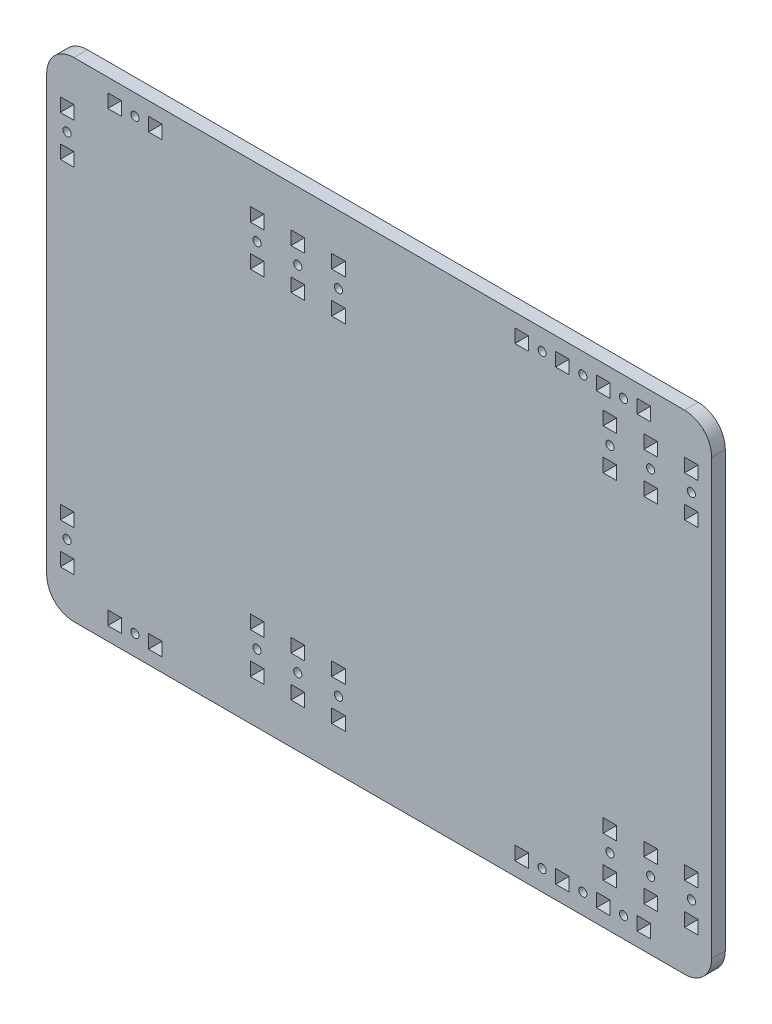
from build123d import *

# Parameters (mm, degrees)
SKETCH1_W           = 245.000446045
SKETCH1_H           = 180
SKETCH1_W_2         = 5
SKETCH1_H_2         = 5
SKETCH1_R           = 1.5
BOSS_EXTRUDE1_DEPTH = 5
FILLET1_R           = 10


with BuildPart() as part:
    # Sketch1 → Boss-Extrude1 (new body)
    with BuildSketch(Plane.XY):
        with Locations((31.175821468, 0)):
            Rectangle(SKETCH1_W, SKETCH1_H)
        with Locations((-66.324847601, -82.5)):
            Rectangle(SKETCH1_W_2, SKETCH1_H_2, mode=Mode.SUBTRACT)
        with Locations((-83.824401555, -72.5)):
            Rectangle(SKETCH1_W_2, SKETCH1_H_2, mode=Mode.SUBTRACT)
        with Locations((-58.824847601, -82.5)):
            Circle(SKETCH1_R, mode=Mode.SUBTRACT)
        with Locations((-51.324847601, -82.5)):
            Rectangle(SKETCH1_W_2, SKETCH1_H_2, mode=Mode.SUBTRACT)
        with Locations((-83.824401555, -65)):
            Circle(SKETCH1_R, mode=Mode.SUBTRACT)
        with Locations((-83.824401555, -57.5)):
            Rectangle(SKETCH1_W_2, SKETCH1_H_2, mode=Mode.SUBTRACT)
        with Locations((-13.824401555, -72.5)):
            Rectangle(SKETCH1_W_2, SKETCH1_H_2, mode=Mode.SUBTRACT)
        with Locations((1.175598445, -72.5)):
            Rectangle(SKETCH1_W_2, SKETCH1_H_2, mode=Mode.SUBTRACT)
        with Locations((16.175598445, -72.5)):
            Rectangle(SKETCH1_W_2, SKETCH1_H_2, mode=Mode.SUBTRACT)
        with Locations((-13.824401555, -65)):
            Circle(SKETCH1_R, mode=Mode.SUBTRACT)
        with Locations((-13.824401555, -57.5)):
            Rectangle(SKETCH1_W_2, SKETCH1_H_2, mode=Mode.SUBTRACT)
        with Locations((1.175598445, -65)):
            Circle(SKETCH1_R, mode=Mode.SUBTRACT)
        with Locations((1.175598445, -57.5)):
            Rectangle(SKETCH1_W_2, SKETCH1_H_2, mode=Mode.SUBTRACT)
        with Locations((16.175598445, -65)):
            Circle(SKETCH1_R, mode=Mode.SUBTRACT)
        with Locations((16.175598445, -57.5)):
            Rectangle(SKETCH1_W_2, SKETCH1_H_2, mode=Mode.SUBTRACT)
        with Locations((83.67604449, -82.5)):
            Rectangle(SKETCH1_W_2, SKETCH1_H_2, mode=Mode.SUBTRACT)
        with Locations((91.17604449, -82.5)):
            Circle(SKETCH1_R, mode=Mode.SUBTRACT)
        with Locations((98.67604449, -82.5)):
            Rectangle(SKETCH1_W_2, SKETCH1_H_2, mode=Mode.SUBTRACT)
        with Locations((106.17604449, -82.5)):
            Circle(SKETCH1_R, mode=Mode.SUBTRACT)
        with Locations((113.67604449, -82.5)):
            Rectangle(SKETCH1_W_2, SKETCH1_H_2, mode=Mode.SUBTRACT)
        with Locations((121.17604449, -82.5)):
            Circle(SKETCH1_R, mode=Mode.SUBTRACT)
        with Locations((116.17604449, -72.5)):
            Rectangle(SKETCH1_W_2, SKETCH1_H_2, mode=Mode.SUBTRACT)
        with Locations((128.67604449, -82.5)):
            Rectangle(SKETCH1_W_2, SKETCH1_H_2, mode=Mode.SUBTRACT)
        with Locations((131.17604449, -72.5)):
            Rectangle(SKETCH1_W_2, SKETCH1_H_2, mode=Mode.SUBTRACT)
        with Locations((146.17604449, -72.5)):
            Rectangle(SKETCH1_W_2, SKETCH1_H_2, mode=Mode.SUBTRACT)
        with Locations((116.17604449, -65)):
            Circle(SKETCH1_R, mode=Mode.SUBTRACT)
        with Locations((116.17604449, -57.5)):
            Rectangle(SKETCH1_W_2, SKETCH1_H_2, mode=Mode.SUBTRACT)
        with Locations((131.17604449, -65)):
            Circle(SKETCH1_R, mode=Mode.SUBTRACT)
        with Locations((131.17604449, -57.5)):
            Rectangle(SKETCH1_W_2, SKETCH1_H_2, mode=Mode.SUBTRACT)
        with Locations((146.17604449, -65)):
            Circle(SKETCH1_R, mode=Mode.SUBTRACT)
        with Locations((146.17604449, -57.5)):
            Rectangle(SKETCH1_W_2, SKETCH1_H_2, mode=Mode.SUBTRACT)
        with Locations((-83.824401555, 57.5)):
            Rectangle(SKETCH1_W_2, SKETCH1_H_2, mode=Mode.SUBTRACT)
        with Locations((-83.824401555, 65)):
            Circle(SKETCH1_R, mode=Mode.SUBTRACT)
        with Locations((-83.824401555, 72.5)):
            Rectangle(SKETCH1_W_2, SKETCH1_H_2, mode=Mode.SUBTRACT)
        with Locations((-66.324847601, 82.5)):
            Rectangle(SKETCH1_W_2, SKETCH1_H_2, mode=Mode.SUBTRACT)
        with Locations((-58.824847601, 82.5)):
            Circle(SKETCH1_R, mode=Mode.SUBTRACT)
        with Locations((-51.324847601, 82.5)):
            Rectangle(SKETCH1_W_2, SKETCH1_H_2, mode=Mode.SUBTRACT)
        with Locations((-13.824401555, 57.5)):
            Rectangle(SKETCH1_W_2, SKETCH1_H_2, mode=Mode.SUBTRACT)
        with Locations((-13.824401555, 65)):
            Circle(SKETCH1_R, mode=Mode.SUBTRACT)
        with Locations((1.175598445, 57.5)):
            Rectangle(SKETCH1_W_2, SKETCH1_H_2, mode=Mode.SUBTRACT)
        with Locations((1.175598445, 65)):
            Circle(SKETCH1_R, mode=Mode.SUBTRACT)
        with Locations((16.175598445, 57.5)):
            Rectangle(SKETCH1_W_2, SKETCH1_H_2, mode=Mode.SUBTRACT)
        with Locations((16.175598445, 65)):
            Circle(SKETCH1_R, mode=Mode.SUBTRACT)
        with Locations((-13.824401555, 72.5)):
            Rectangle(SKETCH1_W_2, SKETCH1_H_2, mode=Mode.SUBTRACT)
        with Locations((1.175598445, 72.5)):
            Rectangle(SKETCH1_W_2, SKETCH1_H_2, mode=Mode.SUBTRACT)
        with Locations((16.175598445, 72.5)):
            Rectangle(SKETCH1_W_2, SKETCH1_H_2, mode=Mode.SUBTRACT)
        with Locations((83.676044481, 82.5)):
            Rectangle(SKETCH1_W_2, SKETCH1_H_2, mode=Mode.SUBTRACT)
        with Locations((91.176044481, 82.5)):
            Circle(SKETCH1_R, mode=Mode.SUBTRACT)
        with Locations((116.17604449, 57.5)):
            Rectangle(SKETCH1_W_2, SKETCH1_H_2, mode=Mode.SUBTRACT)
        with Locations((116.17604449, 65)):
            Circle(SKETCH1_R, mode=Mode.SUBTRACT)
        with Locations((131.17604449, 57.5)):
            Rectangle(SKETCH1_W_2, SKETCH1_H_2, mode=Mode.SUBTRACT)
        with Locations((131.17604449, 65)):
            Circle(SKETCH1_R, mode=Mode.SUBTRACT)
        with Locations((146.17604449, 57.5)):
            Rectangle(SKETCH1_W_2, SKETCH1_H_2, mode=Mode.SUBTRACT)
        with Locations((146.17604449, 65)):
            Circle(SKETCH1_R, mode=Mode.SUBTRACT)
        with Locations((116.17604449, 72.5)):
            Rectangle(SKETCH1_W_2, SKETCH1_H_2, mode=Mode.SUBTRACT)
        with Locations((98.67604449, 82.5)):
            Rectangle(SKETCH1_W_2, SKETCH1_H_2, mode=Mode.SUBTRACT)
        with Locations((106.17604449, 82.5)):
            Circle(SKETCH1_R, mode=Mode.SUBTRACT)
        with Locations((113.67604449, 82.5)):
            Rectangle(SKETCH1_W_2, SKETCH1_H_2, mode=Mode.SUBTRACT)
        with Locations((121.17604449, 82.5)):
            Circle(SKETCH1_R, mode=Mode.SUBTRACT)
        with Locations((131.17604449, 72.5)):
            Rectangle(SKETCH1_W_2, SKETCH1_H_2, mode=Mode.SUBTRACT)
        with Locations((146.17604449, 72.5)):
            Rectangle(SKETCH1_W_2, SKETCH1_H_2, mode=Mode.SUBTRACT)
        with Locations((128.67604449, 82.5)):
            Rectangle(SKETCH1_W_2, SKETCH1_H_2, mode=Mode.SUBTRACT)
    extrude(amount=BOSS_EXTRUDE1_DEPTH)

    # Fillet1
    fillet1_edges = [part.edges().sort_by_distance(p)[0] for p in [
        (153.67604449, 90, 2.5),
        (153.67604449, -90, 2.5),
        (-91.324401555, -90, 2.5),
        (-91.324401555, 90, 2.5),
    ]]
    fillet(fillet1_edges, radius=FILLET1_R)


solid = part.part
